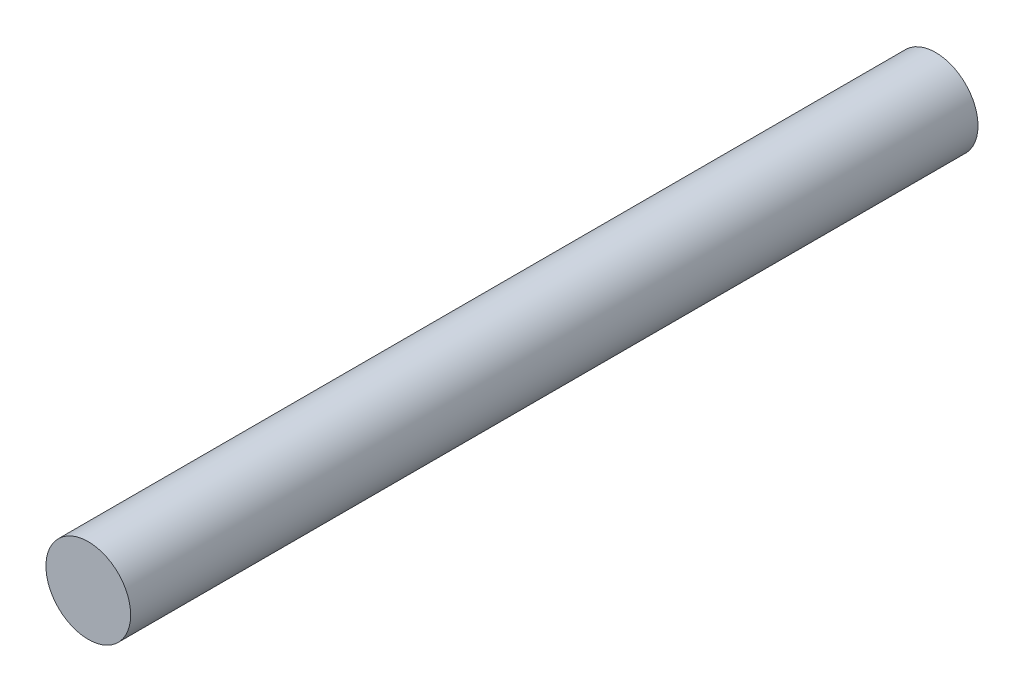
from build123d import *

# Parameters (mm, degrees)
SKETCH_1_R      = 10
EXTRUDE_1_DEPTH = 200


with BuildPart() as part:
    # 草图1 → 凸台-拉伸1 (new body)
    with BuildSketch(Plane.XY):
        Circle(SKETCH_1_R)
    extrude(amount=EXTRUDE_1_DEPTH)


solid = part.part
